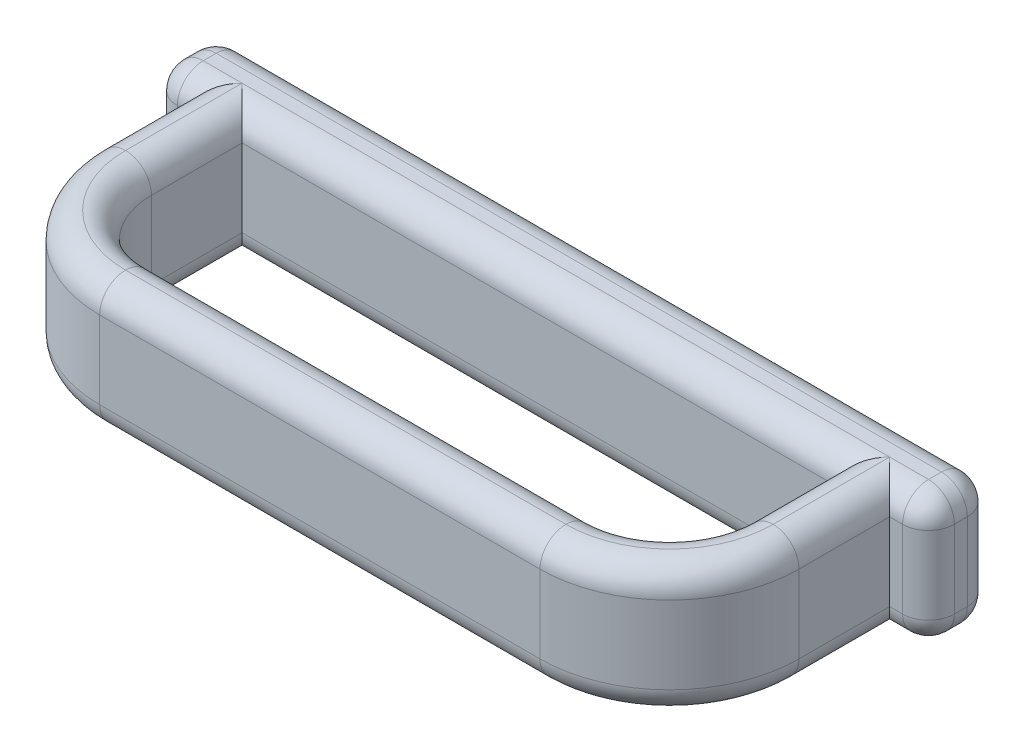
from build123d import *

# Parameters (mm, degrees)
SKETCH1_W           = 60
SKETCH1_H           = 5
BOSS_EXTRUDE1_DEPTH = 10
SKETCH2_W           = 4
SKETCH2_H           = 10
FILLET1_R           = 2


with BuildPart() as part:
    # Sketch1 → Boss-Extrude1 (new body)
    with BuildSketch(Plane(origin=(0, 0, 0), x_dir=(1, 0, 0), z_dir=(0, 1, 0))):
        Rectangle(SKETCH1_W, SKETCH1_H)
    extrude(amount=BOSS_EXTRUDE1_DEPTH)

    # Sweep6: sweep along a curve in space
    with BuildLine() as sweep6_path:
        Line((-25, 5, 2.5), (-25, 5, 9.5))
        ThreePointArc((-25, 5, 9.5), (-22.656854249, 5, 15.156854249), (-17, 5, 17.5))
        Line((-17, 5, 17.5), (17, 5, 17.5))
        ThreePointArc((17, 5, 17.5), (22.656854249, 5, 15.156854249), (25, 5, 9.5))
        Line((25, 5, 2.5), (25, 5, 9.5))
    # Sketch2 → Sweep6 (sweep)
    with BuildSketch(Plane.XY.offset(2.5)):
        with Locations((-25, 5)):
            Rectangle(SKETCH2_W, SKETCH2_H)
    sweep(path=sweep6_path.line)

    # Fillet1
    fillet1_edges = [part.edges().sort_by_distance(p)[0] for p in [
        (-21.242640687, 0, 13.742640687),
        (0, 0, 15.5),
        (21.242640687, 0, 13.742640687),
        (-24.071067812, 0, 16.571067812),
        (0, 0, 19.5),
        (24.071067812, 0, 16.571067812),
        (-28.5, 0, 2.5),
        (-27, 0, 6),
        (-27, 10, 6),
        (-23, 0, 6),
        (0, 0, 2.5),
        (23, 0, 6),
        (27, 0, 6),
        (27, 10, 6),
        (28.5, 0, 2.5),
        (30, 0, 0),
        (0, 0, -2.5),
        (-30, 0, 0),
        (-24.071067812, 10, 16.571067812),
        (24.071067812, 10, 16.571067812),
        (-21.242640687, 10, 13.742640687),
        (21.242640687, 10, 13.742640687),
        (-30, 5, -2.5),
        (-30, 5, 2.5),
        (30, 5, 2.5),
        (30, 5, -2.5),
        (0, 10, -2.5),
        (30, 10, 0),
        (28.5, 10, 2.5),
        (23, 10, 6),
        (0, 10, 2.5),
        (-23, 10, 6),
        (-28.5, 10, 2.5),
        (-30, 10, 0),
        (0, 10, 19.5),
        (0, 10, 15.5),
    ]]
    fillet(fillet1_edges, radius=FILLET1_R - 0.0001)  # a hair under: the kernel refuses the full size


solid = part.part
